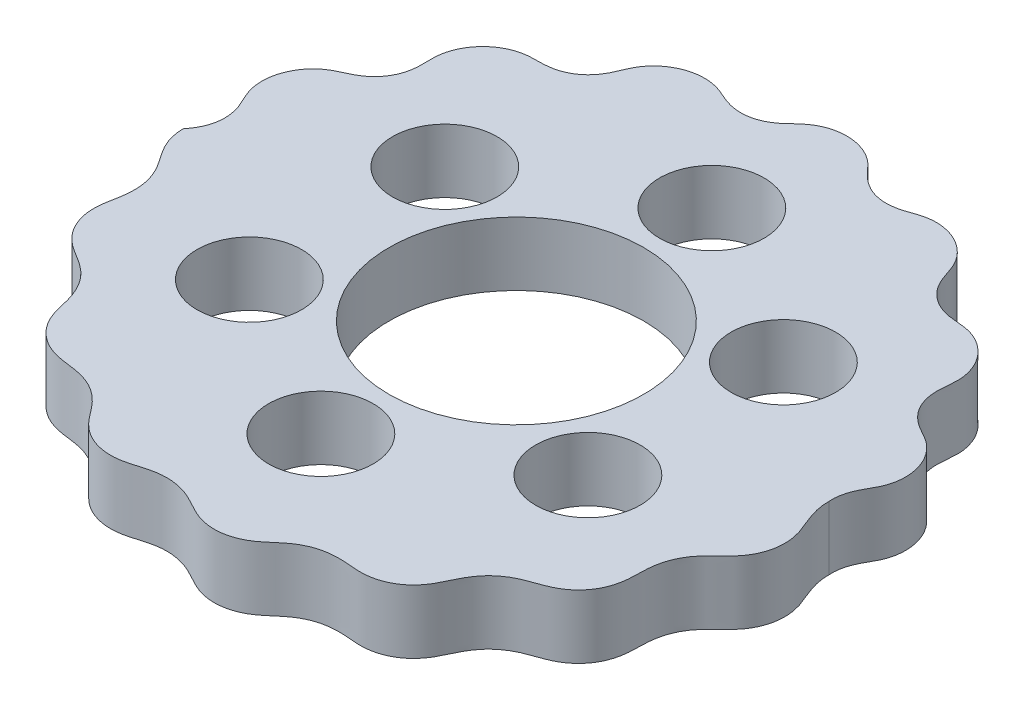
from build123d import *

# Parameters (mm, degrees)
BOSS_EXTRUDE1_DEPTH = 7
SKETCH2_R           = 14
SKETCH2_R_2         = 5.75
CUT_EXTRUDE1_DEPTH  = 10


with BuildPart() as part:
    # Sketch1 → Boss-Extrude1 (new body)
    with BuildSketch(Plane(origin=(0, 0, 0), x_dir=(1, 0, 0), z_dir=(0, 1, 0))):
        with BuildLine():
            add(Edge.make_bspline(
                [(34.375, 0), (34.375, -0.038142251), (34.375625027, -0.095367347), (34.37770847, -0.189812854), (34.383327088, -0.334759611), (34.391432457, -0.47443148), (34.408227988, -0.671828064), (34.440406729, -0.939928919), (34.489975086, -1.238889273), (34.561263947, -1.56679514), (34.644073426, -1.880318784), (34.735649151, -2.178826652), (34.837589777, -2.474093299), (34.948138348, -2.766150188), (35.065080473, -3.055716588), (35.185752591, -3.343721225), (35.321087856, -3.665151702), (35.46645581, -4.02196324), (35.652327174, -4.525247024), (35.876948984, -5.312389423), (36.010779062, -6.373051716), (35.885683151, -7.686926078), (35.435553019, -8.944083753), (34.781761376, -9.969384888), (34.000333993, -10.810650615), (33.192492084, -11.531301262), (32.350190001, -12.385709131), (31.590824231, -13.466612349), (31.063355811, -14.713741726), (30.806445916, -16.07339436), (30.782642498, -17.302701607), (30.770224261, -18.386029822), (30.608820515, -19.492387505), (30.250536914, -20.587620101), (29.586532042, -21.71084823), (28.634372687, -22.668372791), (27.577882282, -23.332554516), (26.496653957, -23.761156062), (25.466130799, -24.091883709), (24.372129746, -24.548077208), (23.280078972, -25.232488654), (22.431237905, -26.054850628), (21.812322556, -26.92194947), (21.390072407, -27.687889476), (21.093935589, -28.307238816), (20.795031054, -28.954591171), (20.45022705, -29.609931717), (19.932458572, -30.382032554), (19.160558718, -31.195578294), (18.09579159, -31.921673157), (16.812101957, -32.389277262), (15.541962495, -32.541400829), (14.366372779, -32.464604239), (13.289646627, -32.354510028), (12.119302336, -32.352725997), (10.87843976, -32.554759204), (9.78324504, -32.978142662), (8.862102522, -33.542828091), (8.154845506, -34.095824004), (7.613358545, -34.566280101), (7.067555022, -35.037376922), (6.486268391, -35.471366259), (5.705526334, -35.931287126), (4.688866215, -36.32483711), (3.432023808, -36.527280284), (2.055608708, -36.404062944), (0.812825235, -35.98797252), (-0.23116539, -35.410725159), (-1.176523057, -34.882826227), (-2.241450695, -34.435589586), (-3.462922288, -34.141064117), (-4.646912973, -34.110679748), (-5.732185605, -34.284044611), (-6.610737688, -34.52177424), (-7.273020496, -34.727482891), (-7.945324065, -34.922039897), (-8.637866607, -35.064148958), (-9.527350777, -35.146540073), (-10.608224585, -35.070566806), (-11.828402869, -34.720788911), (-13.03611328, -34.016837283), (-14.003530938, -33.08707522), (-14.7144375, -32.110484473), (-15.377523371, -31.253664336), (-16.176892482, -30.441536347), (-17.188736756, -29.697530138), (-18.430900829, -29.141677363), (-19.688281266, -28.88652125), (-20.764653927, -28.772330912), (-21.775401837, -28.619414218), (-22.792121868, -28.343181386), (-23.91346104, -27.776233765), (-25.005718449, -26.822617453), (-25.799436375, -25.6734911), (-26.279095979, -24.425678453), (-26.521799074, -23.25383202), (-26.784566764, -22.220243157), (-27.189065564, -21.171950092), (-27.81976771, -20.085657842), (-28.739144291, -19.081766749), (-29.926680593, -18.251276874), (-31.187456669, -17.552746984), (-32.281390036, -16.716193992), (-33.16717683, -15.609448316), (-33.767393318, -14.290041585), (-34.01543713, -12.908366847), (-33.933145501, -11.560642527), (-33.622172908, -10.17028913), (-33.440807843, -8.934570119), (-33.481692067, -7.812705371), (-33.68599073, -6.805783423), (-33.906125628, -6.144495348), (-34.163559932, -5.572344286), (-34.454837337, -5.040091405), (-34.741502583, -4.580559519), (-35.075413424, -4.095647791), (-35.441005805, -3.575764228), (-35.747071155, -3.098535863), (-35.985472245, -2.661598439), (-36.16416231, -2.272237803), (-36.294543542, -1.937664575), (-36.404412493, -1.595529055), (-36.492988463, -1.247705019), (-36.551437092, -0.938570813), (-36.587717209, -0.671140664), (-36.606583541, -0.474036451), (-36.61567308, -0.334499865), (-36.62196808, -0.189678701), (-36.624300325, -0.095328272), (-36.625, -0.038118241), (-36.625, 0)],
                knots=[0.073550961, 0.073550961, 0.073550961, 0.073550961, 0.073550961, 0.074844219, 0.075490848, 0.076137477, 0.077430735, 0.078723993, 0.08131051, 0.083897026, 0.08614545, 0.088393874, 0.090642298, 0.092890723, 0.095139147, 0.097387571, 0.099635995, 0.10188442, 0.105184046, 0.108483673, 0.115082927, 0.125422654, 0.135761848, 0.14610167, 0.153145668, 0.160189665, 0.168738042, 0.177286418, 0.187634189, 0.197978497, 0.207417351, 0.216856205, 0.223011098, 0.229165991, 0.239505453, 0.249844759, 0.260183946, 0.267672781, 0.275161616, 0.283265508, 0.2913694, 0.301718066, 0.312058917, 0.317001181, 0.321943445, 0.32688571, 0.331827974, 0.337538639, 0.343249304, 0.353588288, 0.363927457, 0.374266632, 0.382199364, 0.390132096, 0.39779304, 0.405453984, 0.415801814, 0.426138759, 0.431304122, 0.436469485, 0.441634849, 0.446800212, 0.452066166, 0.45733212, 0.467671128, 0.478010743, 0.488348972, 0.496726644, 0.505104316, 0.51232144, 0.519538563, 0.529884883, 0.541100875, 0.546094941, 0.551089008, 0.556083075, 0.561077142, 0.566246384, 0.571415626, 0.581754127, 0.592093595, 0.602431525, 0.611255631, 0.620079737, 0.626851886, 0.633624034, 0.643968401, 0.656074695, 0.665617083, 0.670388277, 0.675159471, 0.6854978, 0.695836981, 0.70617686, 0.7165146, 0.725281844, 0.734049089, 0.740626219, 0.747203349, 0.75754834, 0.770044949, 0.779393346, 0.788741742, 0.799079452, 0.809418919, 0.819758061, 0.830096637, 0.839057148, 0.848017659, 0.860788702, 0.865960441, 0.871132181, 0.877573531, 0.880794206, 0.884014881, 0.88859195, 0.893169018, 0.897746087, 0.902323156, 0.90490771, 0.907492264, 0.910076817, 0.912661371, 0.915246259, 0.917831147, 0.919123591, 0.920416035, 0.921062257, 0.921708479, 0.923000923, 0.923000923, 0.923000923, 0.923000923, 0.923000923], degree=4))
            add(Edge.make_bspline(
                [(34.375, 0), (34.372677102, 0.034552958), (34.369931691, 0.085611651), (34.365976506, 0.178514503), (34.363899416, 0.286737516), (34.363919925, 0.370355647), (34.365910011, 0.474327691), (34.371208747, 0.601734206), (34.381667532, 0.751217387), (34.399606884, 0.920514622), (34.42336746, 1.089459823), (34.460297377, 1.299336947), (34.534451165, 1.632386304), (34.671619146, 2.081385532), (34.913238734, 2.654462618), (35.264769033, 3.293778898), (35.649686751, 3.940950492), (35.971808475, 4.650225423), (36.212734187, 5.495903249), (36.316783559, 6.47110981), (36.228460042, 7.557208274), (35.89043863, 8.70453823), (35.361832315, 9.687895963), (34.70359921, 10.484547775), (33.979131901, 11.091781054), (33.242475884, 11.526812722), (32.532829824, 11.891270354), (31.90658213, 12.295022465), (31.252988184, 12.834393984), (30.623063729, 13.555878619), (30.084535055, 14.544010487), (29.808008152, 15.699424974), (29.79311887, 16.672672654), (29.866981965, 17.428374223), (29.922786733, 17.975846206), (29.949110136, 18.415610472), (29.943099636, 18.966390122), (29.853127048, 19.712820489), (29.58656893, 20.630052995), (29.050561965, 21.647662551), (28.258926267, 22.59131099), (27.367618518, 23.285539757), (26.451512494, 23.745470343), (25.559863806, 24.006741455), (24.733950752, 24.1108835), (23.952219982, 24.153088957), (23.221537563, 24.256039079), (22.553174814, 24.4293538), (21.954507808, 24.666560268), (21.256319384, 25.053299688), (20.513382266, 25.655455137), (19.947147618, 26.368646436), (19.552746047, 27.126908634), (19.317093872, 27.73124145), (19.174189119, 28.153258086), (19.036769268, 28.576859638), (18.884558382, 28.995727106), (18.659252019, 29.505449824), (18.277238665, 30.164304332), (17.659911582, 30.910917825), (16.742796488, 31.644168843), (15.606391343, 32.202292236), (14.465448529, 32.479504433), (13.49708307, 32.511791059), (12.742392163, 32.410817845), (12.092552583, 32.251628726), (11.461506042, 32.031191387), (10.642777996, 31.732428232), (9.585143582, 31.511114873), (8.399769254, 31.526177042), (7.318846381, 31.832807899), (6.471925415, 32.29032589), (5.798808447, 32.811618366), (5.270708621, 33.326943924), (4.759272214, 33.91968113), (4.171925273, 34.509583181), (3.419990216, 35.055393943), (2.495931304, 35.49911324), (1.401613907, 35.779943717), (0.170881942, 35.829410735), (-0.962087956, 35.631370631), (-1.850877584, 35.281489141), (-2.496545944, 34.896303521), (-2.93605636, 34.564303634), (-3.267951246, 34.274593703), (-3.66704973, 33.895700931), (-4.219881518, 33.375203002), (-4.999123209, 32.791923965), (-6.082485909, 32.30430091), (-7.193667723, 32.126281291), (-8.149732356, 32.183617104), (-8.976158621, 32.371029428), (-9.678553627, 32.619723701), (-10.400834741, 32.95843479), (-11.195494613, 33.275372736), (-12.118938917, 33.477372698), (-13.151817388, 33.511156214), (-14.267298762, 33.325837871), (-15.407616719, 32.877525833), (-16.36061008, 32.244009435), (-17.031368422, 31.5705927), (-17.467094351, 30.962340888), (-17.735939029, 30.484607983), (-17.922888301, 30.088002352), (-18.133667457, 29.582460039), (-18.422659681, 28.884386483), (-18.886987492, 28.034548254), (-19.6656019, 27.141551224), (-20.732506108, 26.426078728), (-21.854218302, 26.044705101), (-22.81670371, 25.937713646), (-23.572228364, 25.935327787), (-24.119942908, 25.932219579), (-24.557828441, 25.909807162), (-25.10185564, 25.842423209), (-25.829978785, 25.670190703), (-26.707604239, 25.305251782), (-27.655447446, 24.664055535), (-28.503052862, 23.779253984), (-29.097920163, 22.817602031), (-29.458729042, 21.849203242), (-29.622371802, 20.918196038), (-29.630794353, 20.0627061), (-29.591599518, 19.265913168), (-29.628135956, 18.521686945), (-29.768448101, 17.68597392), (-30.078310105, 16.779699954), (-30.664792903, 15.819255284), (-31.527147889, 15.002068148), (-32.362560331, 14.502550223), (-33.053948782, 14.188666458), (-33.555975601, 13.963259051), (-33.949984687, 13.766173392), (-34.423968045, 13.485578663), (-35.025410315, 13.034444412), (-35.6864764, 12.344982909), (-36.299750937, 11.371981196), (-36.721153212, 10.214582253), (-36.876724287, 9.095569807), (-36.816974628, 8.072238017), (-36.597431591, 7.169404291), (-36.274636154, 6.40208751), (-35.920376155, 5.703955905), (-35.644105166, 5.019738916), (-35.417286514, 4.199173662), (-35.332297271, 3.399220556), (-35.388280682, 2.59970395), (-35.581741312, 1.828824123), (-35.811946835, 1.241777034), (-36.102779192, 0.707201749), (-36.358975939, 0.336067786), (-36.539258733, 0.105179202), (-36.625, 0)],
                knots=[0.073379942, 0.073379942, 0.073379942, 0.073379942, 0.073379942, 0.074471538, 0.075017335, 0.075563133, 0.076134945, 0.076706758, 0.077850382, 0.078994007, 0.080137631, 0.081281256, 0.082424881, 0.08471213, 0.089286628, 0.093861126, 0.099069298, 0.104277469, 0.109485641, 0.114693812, 0.122572784, 0.130451757, 0.138511613, 0.146571469, 0.152296032, 0.158020594, 0.163745157, 0.169469719, 0.173712688, 0.177955657, 0.186441594, 0.195001278, 0.203560962, 0.20946737, 0.212420574, 0.215373778, 0.218326982, 0.221280186, 0.227186594, 0.235488461, 0.243790327, 0.251894239, 0.259998151, 0.26556746, 0.271136768, 0.276706077, 0.282275385, 0.286582441, 0.290889497, 0.295196553, 0.299503609, 0.307939116, 0.316374624, 0.319362447, 0.322350271, 0.325338094, 0.328325918, 0.331313742, 0.334301565, 0.340277212, 0.348703072, 0.357128932, 0.365554792, 0.373980652, 0.379956299, 0.382944123, 0.385931946, 0.391907594, 0.397883241, 0.406318748, 0.414754256, 0.423368367, 0.427675423, 0.431982479, 0.437551788, 0.443121096, 0.448690405, 0.454259714, 0.462363625, 0.470467537, 0.478769404, 0.48707127, 0.492977678, 0.495930882, 0.498884086, 0.50183729, 0.504790494, 0.510696902, 0.519256586, 0.527816271, 0.536302208, 0.540545176, 0.544788145, 0.550512708, 0.55623727, 0.561961833, 0.567686395, 0.575746252, 0.583806108, 0.59206794, 0.600329772, 0.606207918, 0.609146991, 0.612086064, 0.615025138, 0.617964211, 0.623842357, 0.632360151, 0.640877945, 0.649395738, 0.657913532, 0.663791678, 0.666730752, 0.669669825, 0.672608898, 0.675547971, 0.681426118, 0.68968795, 0.697949782, 0.706009638, 0.714069494, 0.719794057, 0.725518619, 0.731243182, 0.736967744, 0.741210713, 0.745453681, 0.753939619, 0.762499303, 0.771058987, 0.776965395, 0.779918599, 0.782871803, 0.785825007, 0.788778211, 0.794684619, 0.802986486, 0.811288352, 0.819392264, 0.827496176, 0.833065484, 0.838634793, 0.844204102, 0.84977341, 0.854080466, 0.858387522, 0.867001634, 0.871219387, 0.875437141, 0.879654895, 0.883872649, 0.887514251, 0.887514251, 0.887514251, 0.887514251, 0.887514251], degree=4))
        make_face()
    extrude(amount=BOSS_EXTRUDE1_DEPTH)

    # Sketch2 → Cut-Extrude1 (cut)
    with BuildSketch(Plane(origin=(0, 7, 0), x_dir=(1, 0, 0), z_dir=(0, 1, 0))):
        Circle(SKETCH2_R)
        with Locations((0, 21.5)):
            Circle(SKETCH2_R_2)
        with Locations((18.619546181, 10.75)):
            Circle(SKETCH2_R_2)
        with Locations((18.619546181, -10.75)):
            Circle(SKETCH2_R_2)
        with Locations((0, -21.5)):
            Circle(SKETCH2_R_2)
        with Locations((-18.619546181, -10.75)):
            Circle(SKETCH2_R_2)
        with Locations((-18.619546181, 10.75)):
            Circle(SKETCH2_R_2)
    extrude(amount=-CUT_EXTRUDE1_DEPTH, mode=Mode.SUBTRACT)


solid = part.part
